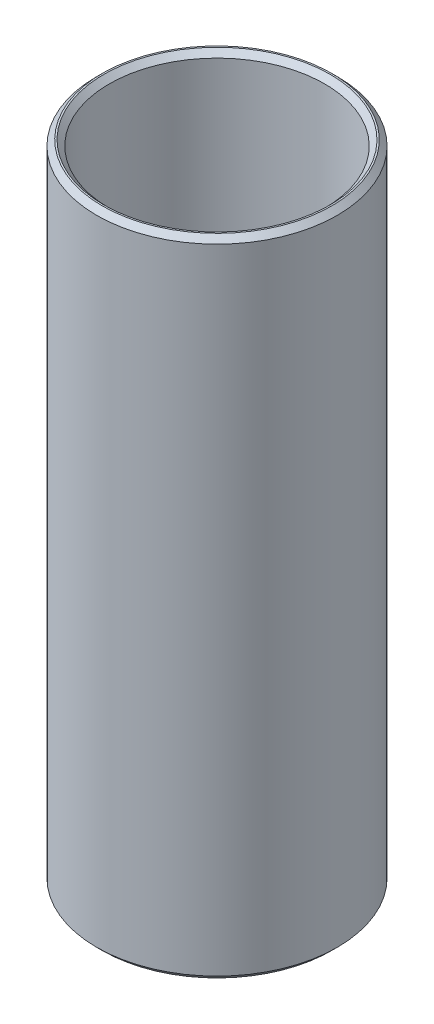
from build123d import *

# Parameters (mm, degrees)
SKETCH1_R           = 35
BOSS_EXTRUDE1_DEPTH = 187.68618563
SKETCH2_R           = 31.334399723
CUT_EXTRUDE1_DEPTH  = 195.103334017
CHAMFER1_SIZE       = 1.598696764


with BuildPart() as part:
    # Sketch1 → Boss-Extrude1 (new body)
    with BuildSketch(Plane(origin=(0, 0, 0), x_dir=(1, 0, 0), z_dir=(0, 1, 0))):
        Circle(SKETCH1_R)
    extrude(amount=BOSS_EXTRUDE1_DEPTH)

    # Sketch2 → Cut-Extrude1 (cut, through all)
    with BuildSketch(Plane(origin=(0, 0, 0), x_dir=(1, 0, 0), z_dir=(0, 1, 0))):
        Circle(SKETCH2_R)
    extrude(amount=CUT_EXTRUDE1_DEPTH, mode=Mode.SUBTRACT)

    # Chamfer1
    chamfer1_edges = [part.edges().sort_by_distance(p)[0] for p in [
        (-31.334399723, 187.68618563, 0),
        (-31.334399723, 0, 0),
        (-35, 0, 0),
        (-35, 187.68618563, 0),
    ]]
    chamfer(chamfer1_edges, length=CHAMFER1_SIZE)


solid = part.part
